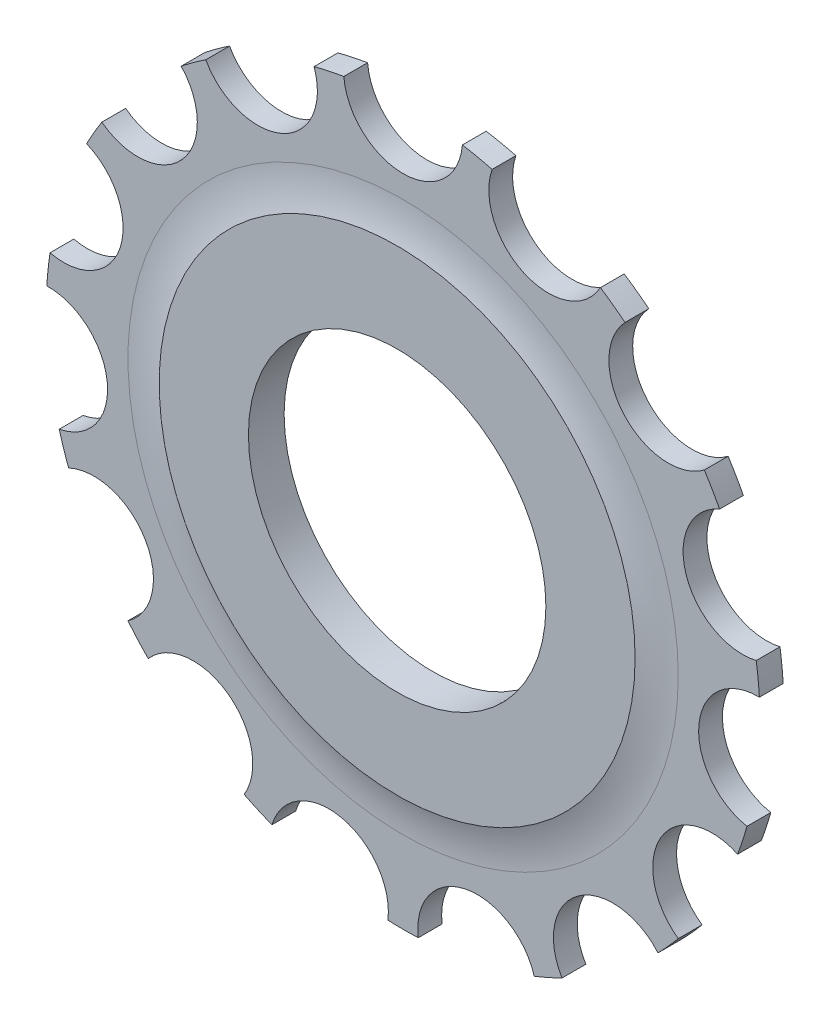
from build123d import *

# Parameters (mm, degrees)
SKETCH1_R            = 12.5
BOSS_EXTRUDE1_DEPTH  = 1.5
SKETCH2_R            = 40
SKETCH2_R_2          = 20
CUT_EXTRUDE1_DEPTH   = 0.5
FILLET1_R            = 10
FILLET1_OF_MIRROR1_R = 10


with BuildPart() as part:
    # Sketch1 → Boss-Extrude1 (new, symmetric)
    with BuildSketch(Plane.XY):
        with BuildLine():
            ThreePointArc((-4.982608643, 29.583333333), (-6.237350725, 29.344428022), (-7.480786198, 29.052329302))
            ThreePointArc((-7.480786198, 29.052329302), (-10.168416077, 22.838636441), (-16.584465184, 24.999110275))
            ThreePointArc((-16.584465184, 24.999110275), (-17.633557569, 24.270509831), (-18.650685145, 23.497913602))
            ThreePointArc((-18.650685145, 23.497913602), (-18.578620637, 16.728265159), (-25.31871703, 16.092313941))
            ThreePointArc((-25.31871703, 16.092313941), (-25.980762114, 15), (-26.595711193, 13.880495168))
            ThreePointArc((-26.595711193, 13.880495168), (-23.776412907, 7.725424859), (-29.675132687, 4.403010332))
            ThreePointArc((-29.675132687, 4.403010332), (-29.835656861, 3.135853898), (-29.942097162, 1.86301302))
            ThreePointArc((-29.942097162, 1.86301302), (-24.863047384, -2.613211582), (-28.900448313, -8.047613763))
            ThreePointArc((-28.900448313, -8.047613763), (-28.531695489, -9.270509831), (-28.111222517, -10.476601005))
            ThreePointArc((-28.111222517, -10.476601005), (-21.650635095, -12.5), (-23.128613874, -19.106732329))
            ThreePointArc((-23.128613874, -19.106732329), (-22.294344764, -20.073918191), (-21.419662115, -21.004715539))
            ThreePointArc((-21.419662115, -21.004715539), (-14.694631307, -20.225424859), (-13.357631979, -26.862123295))
            ThreePointArc((-13.357631979, -26.862123295), (-12.202099292, -27.406363729), (-11.024447543, -27.900923934))
            ThreePointArc((-11.024447543, -27.900923934), (-5.19779227, -24.453690018), (-1.276994164, -29.972809109))
            ThreePointArc((-1.276994164, -29.972809109), (0, -30), (1.276994164, -29.972809109))
            ThreePointArc((1.276994164, -29.972809109), (5.19779227, -24.453690018), (11.024447543, -27.900923934))
            ThreePointArc((11.024447543, -27.900923934), (12.202099292, -27.406363729), (13.357631979, -26.862123295))
            ThreePointArc((13.357631979, -26.862123295), (14.694631307, -20.225424859), (21.419662115, -21.004715539))
            ThreePointArc((21.419662115, -21.004715539), (22.294344764, -20.073918191), (23.128613874, -19.106732329))
            ThreePointArc((23.128613874, -19.106732329), (21.650635095, -12.5), (28.111222517, -10.476601005))
            ThreePointArc((28.111222517, -10.476601005), (28.531695489, -9.270509831), (28.900448313, -8.047613763))
            ThreePointArc((28.900448313, -8.047613763), (24.863047384, -2.613211582), (29.942097162, 1.86301302))
            ThreePointArc((29.942097162, 1.86301302), (29.835656861, 3.135853898), (29.675132687, 4.403010332))
            ThreePointArc((29.675132687, 4.403010332), (23.776412907, 7.725424859), (26.595711193, 13.880495168))
            ThreePointArc((26.595711193, 13.880495168), (25.980762114, 15), (25.31871703, 16.092313941))
            ThreePointArc((25.31871703, 16.092313941), (18.578620637, 16.728265159), (18.650685145, 23.497913602))
            ThreePointArc((18.650685145, 23.497913602), (17.633557569, 24.270509831), (16.584465184, 24.999110275))
            ThreePointArc((16.584465184, 24.999110275), (10.168416077, 22.838636441), (7.480786198, 29.052329302))
            ThreePointArc((7.480786198, 29.052329302), (6.237350725, 29.344428022), (4.982608643, 29.583333333))
            ThreePointArc((4.982608643, 29.583333333), (0, 25), (-4.982608643, 29.583333333))
        make_face()
        Circle(SKETCH1_R, mode=Mode.SUBTRACT)
    extrude(amount=BOSS_EXTRUDE1_DEPTH, both=True)

    # Sketch2 → Cut-Extrude1 (cut)
    with BuildSketch(Plane.XY.offset(1.5)):
        Circle(SKETCH2_R)
        Circle(SKETCH2_R_2, mode=Mode.SUBTRACT)
    cut_extrude1 = extrude(amount=-CUT_EXTRUDE1_DEPTH, mode=Mode.SUBTRACT)

    # Fillet1
    # the kernel refuses this fillet: 10 mm, written as the material it adds along each edge
    with BuildSketch(Plane(origin=(0, 0, 1), x_dir=(1, 0, 0), z_dir=(0, -1, 0))) as fillet1_piece_1:
        with BuildLine():
            CenterArc((23.122498999, 10), FILLET1_R, 251.805127661, 18.194872339)
            Line((20, 0.5), (19.93755002, 0.31))
            ThreePointArc((19.93755002, 0.31), (19.8, 0.25), (19.8, 0))
            Line((19.8, 0), (20, -0.2))
            Line((20, -0.2), (23.122498999, -0.2))
            Line((23.122498999, -0.2), (23.122498999, 0))
        make_face()
    revolve(axis=Axis((0, 0, 1), (0, 0, 1)))

    # Mirror1: Cut-Extrude1 across plane
    add(cut_extrude1.mirror(Plane.XY), mode=Mode.SUBTRACT)

    # Fillet1 of Mirror1
    # the kernel refuses this fillet: 10 mm, written as the material it adds along each edge
    with BuildSketch(Plane(origin=(0, 0, -1), x_dir=(1, 0, 0), z_dir=(0, -1, 0))) as fillet1_of_mirror1_piece_1:
        with BuildLine():
            CenterArc((23.122498999, -10), FILLET1_OF_MIRROR1_R, 90, 18.194872339)
            Line((20, -0.5), (19.93755002, -0.31))
            ThreePointArc((19.93755002, -0.31), (19.8, -0.25), (19.8, 0))
            Line((19.8, 0), (20, 0.2))
            Line((20, 0.2), (23.122498999, 0.2))
            Line((23.122498999, 0.2), (23.122498999, 0))
        make_face()
    revolve(axis=Axis((0, 0, -1), (0, 0, 1)))


solid = part.part
